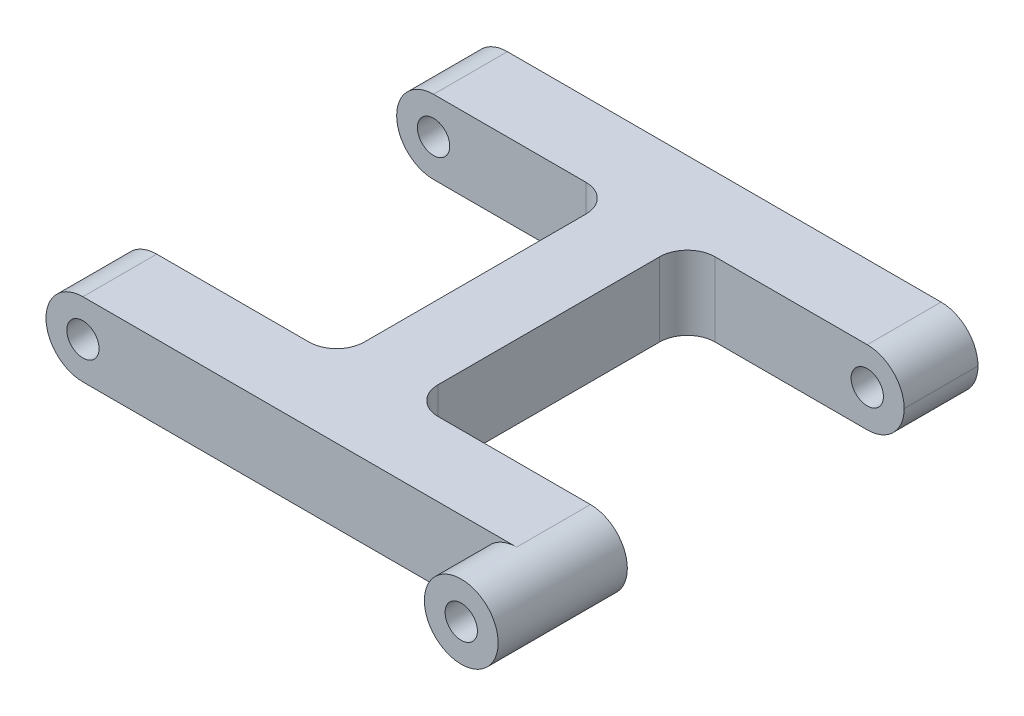
from build123d import *

# Parameters (mm, degrees)
SALIENTE_EXTRUIR1_DEPTH = 4
CROQUIS3_R              = 1.75
CORTAR_EXTRUIR1_DEPTH   = 54.742441329
REDONDEO8_R             = 4
REDONDEO9_R             = 3
SALIENTE_EXTRUIR2_START = 6
CROQUIS4_R              = 4
CROQUIS4_R_2            = 1.75
SALIENTE_EXTRUIR2_DEPTH = 6
CROQUIS5_R              = 3.1
CORTAR_EXTRUIR2_DEPTH   = 3.2


with BuildPart() as part:
    # Croquis2 → Saliente-Extruir1 (new, symmetric)
    with BuildSketch(Plane(origin=(0, 0, 0), x_dir=(1, 0, 0), z_dir=(0, 1, 0))):
        Polygon((27.5, -23), (27.5, -15), (4, -15), (4, 15), (27.5, 15), (27.5, 23), (-27.5, 23), (-27.5, 15), (-4, 15), (-4, -15), (-27.5, -15), (-27.5, -23), align=None)
    extrude(amount=SALIENTE_EXTRUIR1_DEPTH, both=True)

    # Croquis3 → Cortar-Extruir1 (cut, through all)
    with BuildSketch(Plane.XY.offset(23)):
        with Locations((23.5, 0)):
            Circle(CROQUIS3_R)
        with Locations((-23.5, 0)):
            Circle(CROQUIS3_R)
    extrude(amount=-CORTAR_EXTRUIR1_DEPTH, mode=Mode.SUBTRACT)

    # Redondeo8
    redondeo8_edges = [part.edges().sort_by_distance(p)[0] for p in [
        (27.5, -4, -19),
        (27.5, 4, -19),
        (27.5, -4, 19),
        (27.5, 4, 19),
        (-27.5, -4, -19),
        (-27.5, 4, -19),
        (-27.5, -4, 19),
        (-27.5, 4, 19),
    ]]
    fillet(redondeo8_edges, radius=REDONDEO8_R - 0.0001)  # a hair under: the kernel refuses the full size

    # Redondeo9
    redondeo9_edges = [part.edges().sort_by_distance(p)[0] for p in [
        (4, 0, -15),
        (4, 0, 15),
        (-4, 0, 15),
        (-4, 0, -15),
    ]]
    fillet(redondeo9_edges, radius=REDONDEO9_R)

    # Croquis4 → Saliente-Extruir2 (add)
    with BuildSketch(Plane.XY.offset(23).offset(SALIENTE_EXTRUIR2_START)):
        with Locations((23.5, 0)):
            Circle(CROQUIS4_R)
        with Locations((23.5, 0)):
            Circle(CROQUIS4_R_2, mode=Mode.SUBTRACT)
    extrude(amount=-SALIENTE_EXTRUIR2_DEPTH)

    # Croquis5 → Cortar-Extruir2 (cut)
    with BuildSketch(Plane(origin=(0, 0, -23), x_dir=(-1, 0, 0), z_dir=(0, 0, -1))):
        with Locations((-23.5, 0)):
            Circle(CROQUIS5_R)
    extrude(amount=-CORTAR_EXTRUIR2_DEPTH, mode=Mode.SUBTRACT)


solid = part.part
